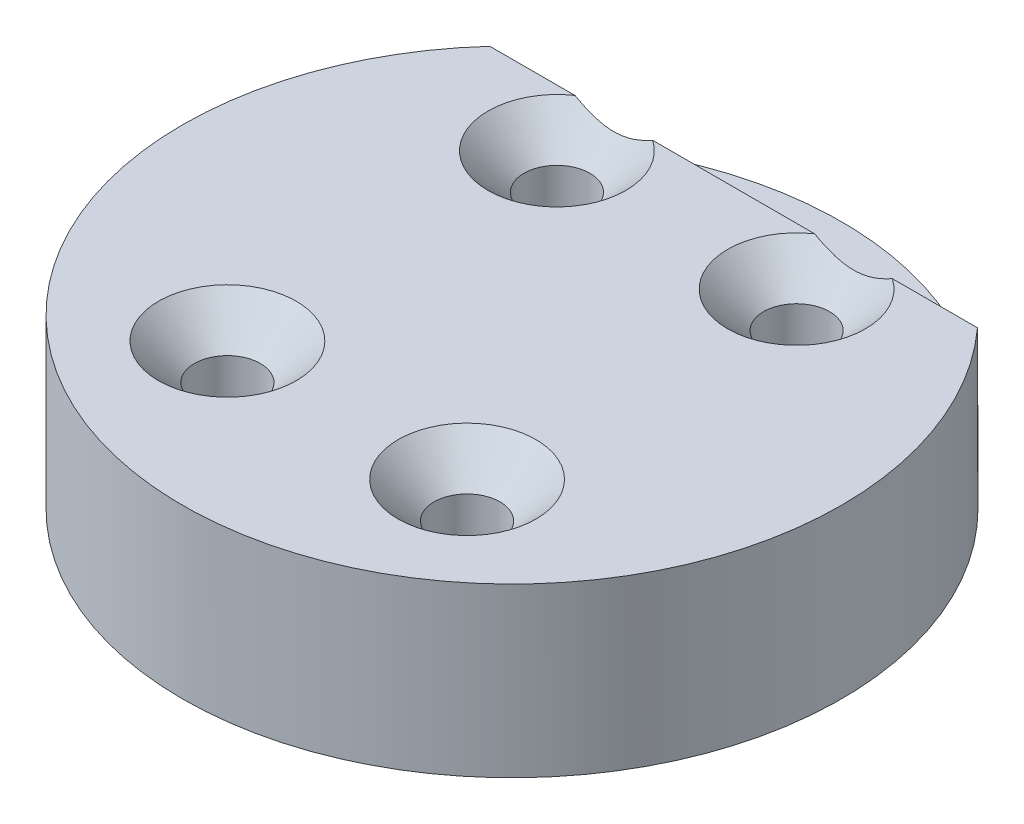
from build123d import *

# Parameters (mm, degrees)
SKETCH1_R           = 27.5
SKETCH1_R_2         = 2.75
BOSS_EXTRUDE1_DEPTH = 14
CHAMFER1_SIZE       = 3
SKETCH2_W           = 55
SKETCH2_H           = 9
CUT_EXTRUDE1_DEPTH  = 7


with BuildPart() as part:
    # Sketch1 → Boss-Extrude1 (new body)
    with BuildSketch(Plane(origin=(0, 0, 0), x_dir=(1, 0, 0), z_dir=(0, 1, 0))):
        Circle(SKETCH1_R)
        with Locations((10, -13.75)):
            Circle(SKETCH1_R_2, mode=Mode.SUBTRACT)
        with Locations((-10, -13.75)):
            Circle(SKETCH1_R_2, mode=Mode.SUBTRACT)
        with Locations((-10, 13.75)):
            Circle(SKETCH1_R_2, mode=Mode.SUBTRACT)
        with Locations((10, 13.75)):
            Circle(SKETCH1_R_2, mode=Mode.SUBTRACT)
    extrude(amount=BOSS_EXTRUDE1_DEPTH)

    # Chamfer1
    chamfer1_edges = [part.edges().sort_by_distance(p)[0] for p in [
        (-12.75, 14, 13.75),
        (7.25, 14, 13.75),
        (7.25, 14, -13.75),
        (-12.75, 14, -13.75),
    ]]
    chamfer(chamfer1_edges, length=CHAMFER1_SIZE)

    # Sketch2 → Cut-Extrude1 (cut)
    with BuildSketch(Plane.XZ.offset(-14)):
        with Locations((0, -23)):
            Rectangle(SKETCH2_W, SKETCH2_H)
    extrude(amount=CUT_EXTRUDE1_DEPTH, mode=Mode.SUBTRACT)


solid = part.part
